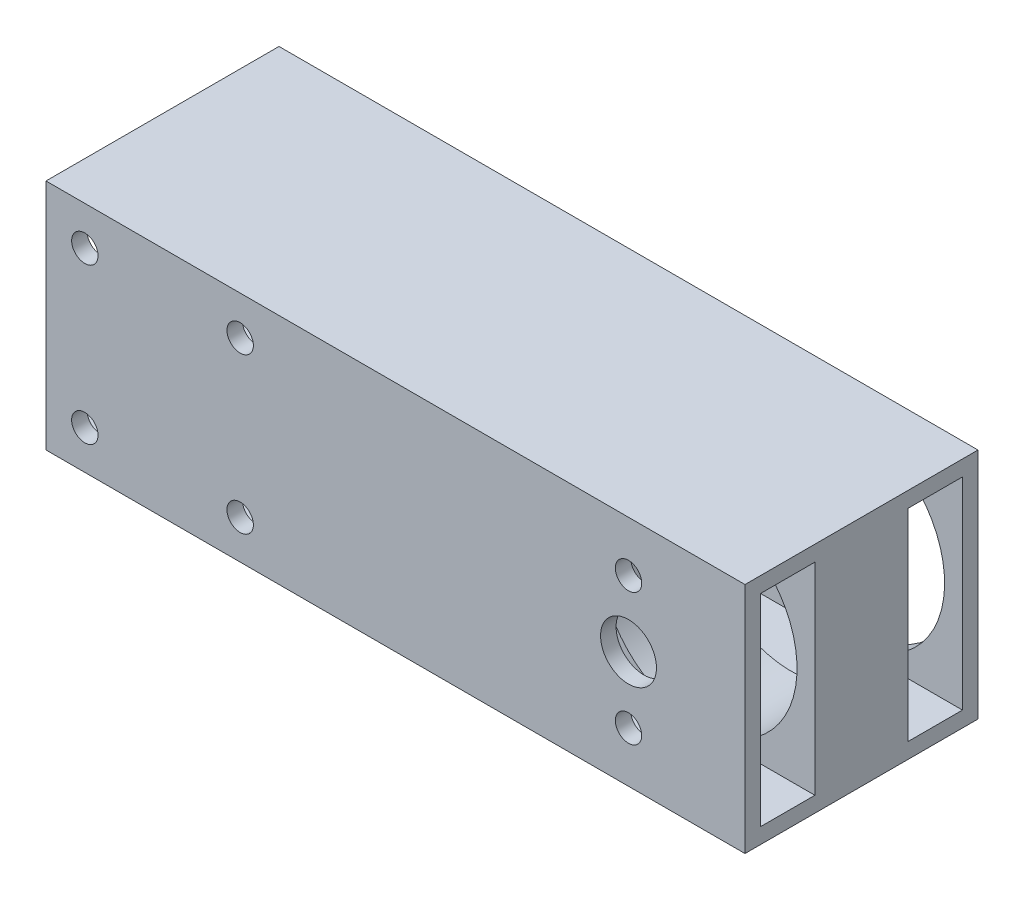
from build123d import *

# Parameters (mm, degrees)
SKETCH1_W            = 30
SKETCH1_H            = 30
SKETCH1_W_2          = 7
SKETCH1_H_2          = 26
BOSS_EXTRUDE3_DEPTH  = 90
SKETCH6_R            = 12.7
CUT_EXTRUDE5_DEPTH   = 23
SKETCH8_R            = 3.6
SKETCH8_R_2          = 1.7
CUT_EXTRUDE6_DEPTH   = 17
SKETCH9_W            = 12
SKETCH9_H            = 26
CUT_EXTRUDE7_DEPTH   = 59
M3_CLEARANCE_HOLE1_D = 3.4


with BuildPart() as part:
    # Sketch1 → Boss-Extrude3 (new body)
    with BuildSketch(Plane(origin=(0, 0, 0), x_dir=(0, 0, -1), z_dir=(1, 0, 0))):
        Rectangle(SKETCH1_W, SKETCH1_H)
        with Locations((-9.5, 0)):
            Rectangle(SKETCH1_W_2, SKETCH1_H_2, mode=Mode.SUBTRACT)
        with Locations((9.5, 0)):
            Rectangle(SKETCH1_W_2, SKETCH1_H_2, mode=Mode.SUBTRACT)
    extrude(amount=BOSS_EXTRUDE3_DEPTH)

    # Sketch6 → Cut-Extrude5 (cut)
    with BuildSketch(Plane(origin=(0, 0, -15), x_dir=(-1, 0, 0), z_dir=(0, 0, -1))):
        with Locations((-75, 0)):
            Circle(SKETCH6_R)
    extrude(amount=-CUT_EXTRUDE5_DEPTH, mode=Mode.SUBTRACT)

    # Sketch8 → Cut-Extrude6 (cut)
    with BuildSketch(Plane.XY.offset(15)):
        with Locations((75, 0)):
            Circle(SKETCH8_R)
        with Locations((75, 8.5)):
            Circle(SKETCH8_R_2)
        with Locations((75, -8.5)):
            Circle(SKETCH8_R_2)
    extrude(amount=-CUT_EXTRUDE6_DEPTH, mode=Mode.SUBTRACT)

    # Sketch9 → Cut-Extrude7 (cut)
    with BuildSketch(Plane.ZY):
        Rectangle(SKETCH9_W, SKETCH9_H)
    extrude(amount=-CUT_EXTRUDE7_DEPTH, mode=Mode.SUBTRACT)

    # M3 Clearance Hole1 (through all)
    with Locations(Plane.XY.offset(15)):
        with Locations((25, 10), (5, -10), (25, -10), (5, 10)):
            Hole(M3_CLEARANCE_HOLE1_D / 2)


solid = part.part
